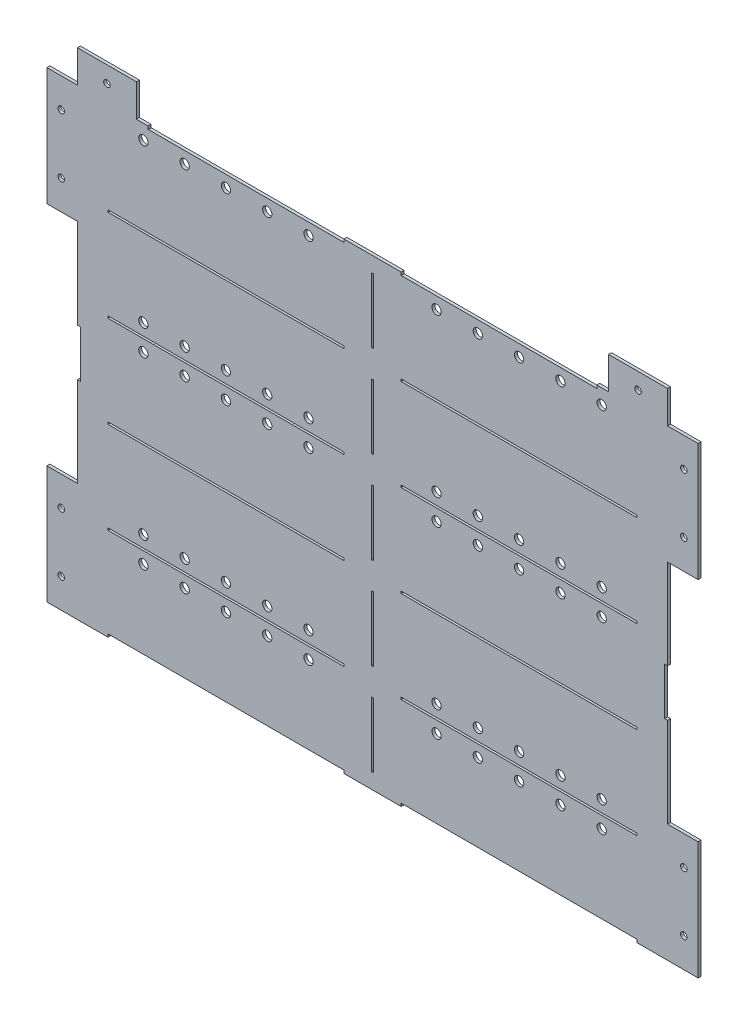
from build123d import *

# Parameters (mm, degrees)
MASTER_SKETCH_W          = 635.3556
MASTER_SKETCH_H          = 498.348
BOSS_EXTRUDE1_DEPTH      = 3.175
SKETCH2_W                = 34.925
SKETCH2_H                = 127
BOSS_EXTRUDE2_DEPTH      = 3.175
M6_CLEARANCE_HOLE1_D     = 7
MIRROR7_COPY_1_SKETCH_W  = 34.925
MIRROR7_COPY_1_SKETCH_H  = 127
MIRROR7_COPY_1_DEPTH     = 3.175
MIRROR7_COPY_2_D         = 7
SKETCH5_W                = 2.286
SKETCH5_H                = 69.85
CUT_EXTRUDE1_DEPTH       = 432.771348596
LPATTERN1_START          = -232.6386
LPATTERN1_OUTLINE_W      = 2.286
LPATTERN1_OUTLINE_H      = 3.175
LPATTERN1_DEPTH          = 69.85
LPATTERN1_START_2        = -133.7818
LPATTERN1_2_OUTLINE_W    = 2.286
LPATTERN1_2_OUTLINE_H    = 3.175
LPATTERN1_2_DEPTH        = 69.85
LPATTERN1_START_3        = -34.925
LPATTERN1_3_OUTLINE_W    = 2.286
LPATTERN1_3_OUTLINE_H    = 3.175
LPATTERN1_3_DEPTH        = 69.85
LPATTERN1_START_4        = 63.9318
LPATTERN1_4_OUTLINE_W    = 2.286
LPATTERN1_4_OUTLINE_H    = 3.175
LPATTERN1_4_DEPTH        = 69.85
SKETCH7_W                = 254
SKETCH7_H                = 2.286
CUT_EXTRUDE3_DEPTH       = 432.771348596
LPATTERN2_START          = -149.4282
LPATTERN2_OUTLINE_W      = 254
LPATTERN2_OUTLINE_H      = 3.175
LPATTERN2_DEPTH          = 2.286
LPATTERN2_START_2        = -50.5714
LPATTERN2_2_OUTLINE_W    = 254
LPATTERN2_2_OUTLINE_H    = 3.175
LPATTERN2_2_DEPTH        = 2.286
LPATTERN2_START_3        = 48.2854
LPATTERN2_3_OUTLINE_W    = 254
LPATTERN2_3_OUTLINE_H    = 3.175
LPATTERN2_3_DEPTH        = 2.286
SKETCH10_W               = 63.5
SKETCH10_H               = 34.925
SKETCH10_R               = 3
BOSS_EXTRUDE3_DEPTH      = 3.175
M6_CLEARANCE_HOLE2_D     = 7
SKETCH6_W                = 254
SKETCH6_H                = 3.175
SKETCH6_W_2              = 210.6549
CUT_EXTRUDE2_DEPTH       = 453.825636414
SKETCH15_W               = 6.35
SKETCH15_H               = 50.8
CUT_EXTRUDE4_DEPTH       = 453.825636414
SKETCH16_R               = 5
CUT_EXTRUDE5_DEPTH       = 453.825636414
LPATTERN3_OUTLINE_R      = 5
LPATTERN3_DEPTH          = 3.175
MIRROR10_COPY_1_SKETCH_R = 5
MIRROR10_COPY_1_DEPTH    = 453.825636414
MIRROR10_COPY_2_SKETCH_R = 5
MIRROR10_COPY_2_DEPTH    = 3.175
LPATTERN4_OUTLINE_R      = 5
LPATTERN4_DEPTH          = 3.175
LPATTERN6_OUTLINE_R      = 5
LPATTERN6_DEPTH          = 3.175
SKETCH18_W               = 2.0245
SKETCH18_H               = 127
CUT_EXTRUDE6_DEPTH       = 453.825636414


# Read off the part's stored shape, not the designer's step: LPattern1, LPattern2, LPattern3, LPattern4, LPattern6
with BuildPart() as part:
    # Master Sketch → Boss-Extrude1 (new body)
    with BuildSketch(Plane.XY):
        Rectangle(MASTER_SKETCH_W, MASTER_SKETCH_H)
    extrude(amount=BOSS_EXTRUDE1_DEPTH)

    # Sketch2 → Boss-Extrude2 (add)
    with BuildSketch(Plane.XY.offset(3.175)):
        with Locations((-335.1403, -185.674)):
            Rectangle(SKETCH2_W, SKETCH2_H)
    boss_extrude2 = extrude(amount=-BOSS_EXTRUDE2_DEPTH)

    # M6 Clearance Hole1 (through all)
    with Locations(Plane.XY.offset(3.175)):
        with Locations((-335.1403, -217.424), (-335.1403, -153.924)):
            m6_clearance_hole1 = Hole(M6_CLEARANCE_HOLE1_D / 2)

    # Mirror1: Boss-Extrude2, M6 Clearance Hole1 across plane
    add(boss_extrude2.mirror(Plane(origin=(0, 0, 0), x_dir=(0, 0, 1), z_dir=(1, 0, 0))))
    add(m6_clearance_hole1.mirror(Plane(origin=(0, 0, 0), x_dir=(0, 0, 1), z_dir=(1, 0, 0))), mode=Mode.SUBTRACT)

    # Mirror7: Boss-Extrude2, M6 Clearance Hole1 across plane
    add(boss_extrude2.mirror(Plane.ZX))
    add(m6_clearance_hole1.mirror(Plane.ZX), mode=Mode.SUBTRACT)

    # Mirror7 copy 1 sketch → Mirror7 copy 1 (add)
    with BuildSketch(Plane(origin=(0, 0, 3.175), x_dir=(-1, 0, 0), z_dir=(0, 0, 1))):
        with Locations((-335.1403, -185.674)):
            Rectangle(MIRROR7_COPY_1_SKETCH_W, MIRROR7_COPY_1_SKETCH_H)
    extrude(amount=-MIRROR7_COPY_1_DEPTH)

    # Mirror7 copy 2 (through all)
    with Locations(Plane(origin=(0, 0, 3.175), x_dir=(-1, 0, 0), z_dir=(0, 0, 1))):
        with Locations((-335.1403, -217.424), (-335.1403, -153.924)):
            Hole(MIRROR7_COPY_2_D / 2)

    # Sketch5 → Cut-Extrude1 (cut, through all)
    with BuildSketch(Plane.XY.offset(3.175)):
        with Locations((0, 197.7136)):
            Rectangle(SKETCH5_W, SKETCH5_H)
    extrude(amount=-CUT_EXTRUDE1_DEPTH, mode=Mode.SUBTRACT)

    # LPattern1 outline → LPattern1 (cut)
    with BuildSketch(Plane(origin=(0, 0, 0), x_dir=(1, 0, 0), z_dir=(0, 1, 0)).offset(LPATTERN1_START)):
        with Locations((0, -1.5875)):
            Rectangle(LPATTERN1_OUTLINE_W, LPATTERN1_OUTLINE_H)
    extrude(amount=LPATTERN1_DEPTH, mode=Mode.SUBTRACT)

    # LPattern1 2 outline → LPattern1 2 (cut)
    with BuildSketch(Plane(origin=(0, 0, 0), x_dir=(1, 0, 0), z_dir=(0, 1, 0)).offset(LPATTERN1_START_2)):
        with Locations((0, -1.5875)):
            Rectangle(LPATTERN1_2_OUTLINE_W, LPATTERN1_2_OUTLINE_H)
    extrude(amount=LPATTERN1_2_DEPTH, mode=Mode.SUBTRACT)

    # LPattern1 3 outline → LPattern1 3 (cut)
    with BuildSketch(Plane(origin=(0, 0, 0), x_dir=(1, 0, 0), z_dir=(0, 1, 0)).offset(LPATTERN1_START_3)):
        with Locations((0, -1.5875)):
            Rectangle(LPATTERN1_3_OUTLINE_W, LPATTERN1_3_OUTLINE_H)
    extrude(amount=LPATTERN1_3_DEPTH, mode=Mode.SUBTRACT)

    # LPattern1 4 outline → LPattern1 4 (cut)
    with BuildSketch(Plane(origin=(0, 0, 0), x_dir=(1, 0, 0), z_dir=(0, 1, 0)).offset(LPATTERN1_START_4)):
        with Locations((0, -1.5875)):
            Rectangle(LPATTERN1_4_OUTLINE_W, LPATTERN1_4_OUTLINE_H)
    extrude(amount=LPATTERN1_4_DEPTH, mode=Mode.SUBTRACT)

    # Sketch7 → Cut-Extrude3 (cut, through all)
    with BuildSketch(Plane.XY.offset(3.175)):
        with Locations((-157.8229, 148.2852)):
            Rectangle(SKETCH7_W, SKETCH7_H)
    cut_extrude3 = extrude(amount=-CUT_EXTRUDE3_DEPTH, mode=Mode.SUBTRACT)

    # LPattern2 outline → LPattern2 (cut)
    with BuildSketch(Plane(origin=(0, 0, 0), x_dir=(1, 0, 0), z_dir=(0, 1, 0)).offset(LPATTERN2_START)):
        with Locations((-157.8229, -1.5875)):
            Rectangle(LPATTERN2_OUTLINE_W, LPATTERN2_OUTLINE_H)
    lpattern2 = extrude(amount=LPATTERN2_DEPTH, mode=Mode.SUBTRACT)

    # LPattern2 2 outline → LPattern2 2 (cut)
    with BuildSketch(Plane(origin=(0, 0, 0), x_dir=(1, 0, 0), z_dir=(0, 1, 0)).offset(LPATTERN2_START_2)):
        with Locations((-157.8229, -1.5875)):
            Rectangle(LPATTERN2_2_OUTLINE_W, LPATTERN2_2_OUTLINE_H)
    lpattern2_2 = extrude(amount=LPATTERN2_2_DEPTH, mode=Mode.SUBTRACT)

    # LPattern2 3 outline → LPattern2 3 (cut)
    with BuildSketch(Plane(origin=(0, 0, 0), x_dir=(1, 0, 0), z_dir=(0, 1, 0)).offset(LPATTERN2_START_3)):
        with Locations((-157.8229, -1.5875)):
            Rectangle(LPATTERN2_3_OUTLINE_W, LPATTERN2_3_OUTLINE_H)
    lpattern2_3 = extrude(amount=LPATTERN2_3_DEPTH, mode=Mode.SUBTRACT)

    # Mirror4: Cut-Extrude3, LPattern2, LPattern2 2, LPattern2 3 across plane
    add(cut_extrude3.mirror(Plane(origin=(0, 0, 0), x_dir=(0, 0, 1), z_dir=(1, 0, 0))), mode=Mode.SUBTRACT)
    add(lpattern2.mirror(Plane(origin=(0, 0, 0), x_dir=(0, 0, 1), z_dir=(1, 0, 0))), mode=Mode.SUBTRACT)
    add(lpattern2_2.mirror(Plane(origin=(0, 0, 0), x_dir=(0, 0, 1), z_dir=(1, 0, 0))), mode=Mode.SUBTRACT)
    add(lpattern2_3.mirror(Plane(origin=(0, 0, 0), x_dir=(0, 0, 1), z_dir=(1, 0, 0))), mode=Mode.SUBTRACT)

    # Sketch10 → Boss-Extrude3 (add)
    with BuildSketch(Plane.XY.offset(3.175)):
        with Locations((-285.9278, 266.6365)):
            Rectangle(SKETCH10_W, SKETCH10_H)
        with Locations((-285.9278, 266.6365)):
            Circle(SKETCH10_R, mode=Mode.SUBTRACT)
    boss_extrude3 = extrude(amount=-BOSS_EXTRUDE3_DEPTH)

    # M6 Clearance Hole2 (through all)
    with Locations(Plane.XY.offset(3.175)):
        with Locations((-285.9278, 266.6365)):
            m6_clearance_hole2 = Hole(M6_CLEARANCE_HOLE2_D / 2)

    # Mirror6: Boss-Extrude3, M6 Clearance Hole2 across plane
    add(boss_extrude3.mirror(Plane(origin=(0, 0, 0), x_dir=(0, 0, 1), z_dir=(1, 0, 0))))
    add(m6_clearance_hole2.mirror(Plane(origin=(0, 0, 0), x_dir=(0, 0, 1), z_dir=(1, 0, 0))), mode=Mode.SUBTRACT)

    # Sketch6 → Cut-Extrude2 (cut, through all)
    with BuildSketch(Plane.XY.offset(3.175)):
        with Locations((-157.8229, -247.5865)):
            Rectangle(SKETCH6_W, SKETCH6_H)
        with Locations((157.8229, -247.5865)):
            Rectangle(SKETCH6_W, SKETCH6_H)
        with Locations((-136.15035, 247.5865)):
            Rectangle(SKETCH6_W_2, SKETCH6_H)
        with Locations((136.15035, 247.5865)):
            Rectangle(SKETCH6_W_2, SKETCH6_H)
    extrude(amount=-CUT_EXTRUDE2_DEPTH, mode=Mode.SUBTRACT)

    # Sketch15 → Cut-Extrude4 (cut, through all)
    with BuildSketch(Plane(origin=(0, 0, 0), x_dir=(-1, 0, 0), z_dir=(0, 0, -1))):
        with Locations((317.6778, 0)):
            Rectangle(SKETCH15_W, SKETCH15_H)
    cut_extrude4 = extrude(amount=-CUT_EXTRUDE4_DEPTH, mode=Mode.SUBTRACT)

    # Mirror8: Cut-Extrude4 across plane
    add(cut_extrude4.mirror(Plane(origin=(0, 0, 0), x_dir=(0, 0, 1), z_dir=(1, 0, 0))), mode=Mode.SUBTRACT)

    # Sketch16 → Cut-Extrude5 (cut, through all)
    with BuildSketch(Plane(origin=(0, 0, 0), x_dir=(-1, 0, 0), z_dir=(0, 0, -1))):
        with Locations((-157.8229, -162.1282)):
            Circle(SKETCH16_R)
    cut_extrude5 = extrude(amount=-CUT_EXTRUDE5_DEPTH, mode=Mode.SUBTRACT)

    # LPattern3 outline → LPattern3 (cut)
    with BuildSketch(Plane.XY):
        with Locations((202.2729, -162.1282)):
            Circle(LPATTERN3_OUTLINE_R)
        with Locations((68.9229, -162.1282)):
            Circle(LPATTERN3_OUTLINE_R)
        with Locations((113.3729, -162.1282)):
            Circle(LPATTERN3_OUTLINE_R)
        with Locations((246.7229, -162.1282)):
            Circle(LPATTERN3_OUTLINE_R)
    lpattern3 = extrude(amount=LPATTERN3_DEPTH, mode=Mode.SUBTRACT)

    # Mirror9: Cut-Extrude5, LPattern3 across plane
    add(cut_extrude5.mirror(Plane(origin=(0, 0, 0), x_dir=(0, 0, 1), z_dir=(1, 0, 0))), mode=Mode.SUBTRACT)
    add(lpattern3.mirror(Plane(origin=(0, 0, 0), x_dir=(0, 0, 1), z_dir=(1, 0, 0))), mode=Mode.SUBTRACT)

    # Mirror10: Cut-Extrude5, LPattern3 across plane
    add(cut_extrude5.mirror(Plane.ZX.offset(-148.2852)), mode=Mode.SUBTRACT)
    add(lpattern3.mirror(Plane.ZX.offset(-148.2852)), mode=Mode.SUBTRACT)

    # Mirror10 copy 1 sketch → Mirror10 copy 1 (cut, through all)
    with BuildSketch(Plane(origin=(0, -296.5704, 0), x_dir=(1, 0, 0), z_dir=(0, 0, -1))):
        with Locations((-157.8229, -162.1282)):
            Circle(MIRROR10_COPY_1_SKETCH_R)
    extrude(amount=-MIRROR10_COPY_1_DEPTH, mode=Mode.SUBTRACT)

    # Mirror10 copy 2 sketch → Mirror10 copy 2 (cut)
    with BuildSketch(Plane(origin=(0, -296.5704, 0), x_dir=(-1, 0, 0), z_dir=(0, 0, 1))):
        with Locations((202.2729, -162.1282)):
            Circle(MIRROR10_COPY_2_SKETCH_R)
        with Locations((68.9229, -162.1282)):
            Circle(MIRROR10_COPY_2_SKETCH_R)
        with Locations((113.3729, -162.1282)):
            Circle(MIRROR10_COPY_2_SKETCH_R)
        with Locations((246.7229, -162.1282)):
            Circle(MIRROR10_COPY_2_SKETCH_R)
    extrude(amount=MIRROR10_COPY_2_DEPTH, mode=Mode.SUBTRACT)

    # LPattern4 outline → LPattern4 (cut)
    with BuildSketch(Plane.XY):
        with Locations((157.8229, 233.299)):
            Circle(LPATTERN4_OUTLINE_R)
        with Locations((113.3729, 233.299)):
            Circle(LPATTERN4_OUTLINE_R)
        with Locations((246.7229, 233.299)):
            Circle(LPATTERN4_OUTLINE_R)
        with Locations((68.9229, 233.299)):
            Circle(LPATTERN4_OUTLINE_R)
        with Locations((202.2729, 233.299)):
            Circle(LPATTERN4_OUTLINE_R)
        with Locations((-157.8229, 233.299)):
            Circle(LPATTERN4_OUTLINE_R)
        with Locations((-113.3729, 233.299)):
            Circle(LPATTERN4_OUTLINE_R)
        with Locations((-246.7229, 233.299)):
            Circle(LPATTERN4_OUTLINE_R)
        with Locations((-68.9229, 233.299)):
            Circle(LPATTERN4_OUTLINE_R)
        with Locations((-202.2729, 233.299)):
            Circle(LPATTERN4_OUTLINE_R)
    extrude(amount=LPATTERN4_DEPTH, mode=Mode.SUBTRACT)

    # LPattern6 outline → LPattern6 (cut)
    with BuildSketch(Plane.XY):
        with Locations((157.8229, 63.2714)):
            Circle(LPATTERN6_OUTLINE_R)
        with Locations((113.3729, 63.2714)):
            Circle(LPATTERN6_OUTLINE_R)
        with Locations((246.7229, 63.2714)):
            Circle(LPATTERN6_OUTLINE_R)
        with Locations((68.9229, 63.2714)):
            Circle(LPATTERN6_OUTLINE_R)
        with Locations((202.2729, 63.2714)):
            Circle(LPATTERN6_OUTLINE_R)
        with Locations((-157.8229, 63.2714)):
            Circle(LPATTERN6_OUTLINE_R)
        with Locations((-113.3729, 63.2714)):
            Circle(LPATTERN6_OUTLINE_R)
        with Locations((-246.7229, 63.2714)):
            Circle(LPATTERN6_OUTLINE_R)
        with Locations((-68.9229, 63.2714)):
            Circle(LPATTERN6_OUTLINE_R)
        with Locations((-202.2729, 63.2714)):
            Circle(LPATTERN6_OUTLINE_R)
        with Locations((157.8229, 35.5854)):
            Circle(LPATTERN6_OUTLINE_R)
        with Locations((113.3729, 35.5854)):
            Circle(LPATTERN6_OUTLINE_R)
        with Locations((246.7229, 35.5854)):
            Circle(LPATTERN6_OUTLINE_R)
        with Locations((68.9229, 35.5854)):
            Circle(LPATTERN6_OUTLINE_R)
        with Locations((202.2729, 35.5854)):
            Circle(LPATTERN6_OUTLINE_R)
        with Locations((-157.8229, 35.5854)):
            Circle(LPATTERN6_OUTLINE_R)
        with Locations((-113.3729, 35.5854)):
            Circle(LPATTERN6_OUTLINE_R)
        with Locations((-246.7229, 35.5854)):
            Circle(LPATTERN6_OUTLINE_R)
        with Locations((-68.9229, 35.5854)):
            Circle(LPATTERN6_OUTLINE_R)
        with Locations((-202.2729, 35.5854)):
            Circle(LPATTERN6_OUTLINE_R)
    extrude(amount=LPATTERN6_DEPTH, mode=Mode.SUBTRACT)

    # Sketch18 → Cut-Extrude6 (cut, through all)
    with BuildSketch(Plane.XY.offset(3.175)):
        with Locations((351.59055, -185.674)):
            Rectangle(SKETCH18_W, SKETCH18_H)
        with Locations((351.59055, 185.674)):
            Rectangle(SKETCH18_W, SKETCH18_H)
    cut_extrude6 = extrude(amount=-CUT_EXTRUDE6_DEPTH, mode=Mode.SUBTRACT)

    # Mirror11: Cut-Extrude6 across plane
    add(cut_extrude6.mirror(Plane(origin=(0, 0, 0), x_dir=(0, 0, 1), z_dir=(1, 0, 0))), mode=Mode.SUBTRACT)


solid = part.part
